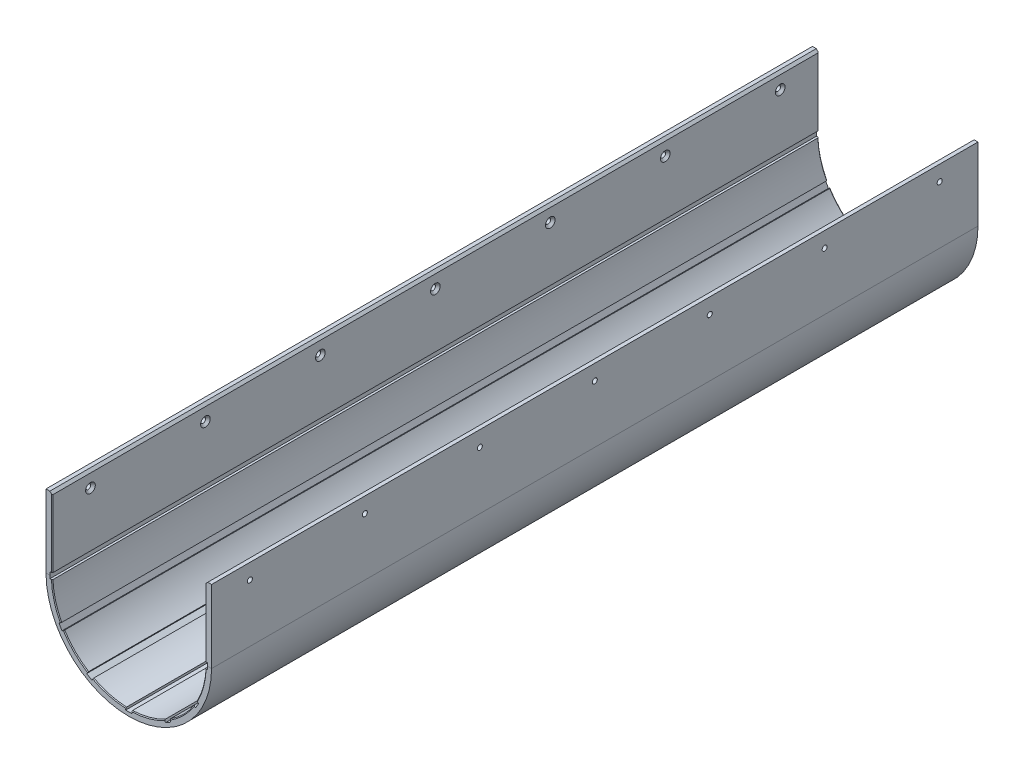
from build123d import *

# Parameters (mm, degrees)
SM_BASE_FLANGE_1_DEPTH     = 500
CHAMFER_2_SIZE             = 1
CUT_EXTRUDE_1_DEPTH        = 1012.596757607
PATTERN_CIRCULAR_1_COUNT   = 4
PATTERN_CIRCULAR_1_ANGLE   = 90
F_1_THE_OTHER_WAY_COUNT    = 4
F_1_THE_OTHER_WAY_ANGLE    = 90
CHAMFER_1_SIZE             = 3
HOLE_WIZARD_M61_AT_2_COUNT = 2
HOLE_WIZARD_M61_AT_2_PITCH = 150
HOLE_WIZARD_M61_AT_3_COUNT = 2
HOLE_WIZARD_M61_AT_3_PITCH = 300
HOLE_WIZARD_M61_AT_4_COUNT = 2
HOLE_WIZARD_M61_AT_4_PITCH = 450
HOLE_WIZARD_M61_AT_5_COUNT = 2
HOLE_WIZARD_M61_AT_5_PITCH = 600
HOLE_WIZARD_M61_AT_6_COUNT = 2
HOLE_WIZARD_M61_AT_6_PITCH = 750
HOLE_WIZARD_M61_AT_7_COUNT = 2
HOLE_WIZARD_M61_AT_7_PITCH = 900


# Sheet-metal steps are written as plain solids
with BuildPart() as part:
    # Sketch 2 → Базовая кромка1 (new, symmetric)
    with BuildSketch(Plane.XY):
        with BuildLine():
            Line((100, 95), (100, 0))
            ThreePointArc((100, 0), (0, -100), (-100, 0))
            Line((-100, 0), (-100, 95))
            Line((-100, 95), (-108, 95))
            Line((-108, 95), (-108, 0))
            ThreePointArc((-108, 0), (0, -108), (108, 0))
            Line((108, 0), (108, 95))
            Line((108, 95), (100, 95))
        make_face()
    extrude(amount=SM_BASE_FLANGE_1_DEPTH, both=True)

    # Фаска2
    chamfer_2_edges = [part.edges().sort_by_distance(p)[0] for p in [
        (100, 47.5, 500),
        (0, -100, 500),
        (-100, 47.5, 500),
        (0, -100, -500),
        (100, 47.5, -500),
        (-100, 47.5, -500),
    ]]
    chamfer(chamfer_2_edges, length=CHAMFER_2_SIZE)

    # Эскиз7 → Вырез-Вытянуть1 (cut, symmetric)
    with BuildSketch(Plane.XY.offset(500)):
        Polygon((0, 0), (-4, -102.92230079), (4, -102.92230079), align=None)
    cut_extrude_1 = extrude(amount=CUT_EXTRUDE_1_DEPTH, both=True, mode=Mode.SUBTRACT)

    # Круговой массив1: Вырез-Вытянуть1 ×4 about axis
    pattern_circular_1_axis = Axis((0, 0, 0), (0, 0, -1))
    for i in range(1, PATTERN_CIRCULAR_1_COUNT):
        add(cut_extrude_1.rotate(pattern_circular_1_axis, i * PATTERN_CIRCULAR_1_ANGLE / (PATTERN_CIRCULAR_1_COUNT - 1)), mode=Mode.SUBTRACT)

    # 1 the other way: Вырез-Вытянуть1 ×4 about axis
    f_1_the_other_way_axis = Axis((0, 0, 0), (0, 0, 1))
    for i in range(1, F_1_THE_OTHER_WAY_COUNT):
        add(cut_extrude_1.rotate(f_1_the_other_way_axis, i * F_1_THE_OTHER_WAY_ANGLE / (F_1_THE_OTHER_WAY_COUNT - 1)), mode=Mode.SUBTRACT)

    # Фаска1
    chamfer_1_edges = [part.edges().sort_by_distance(p)[0] for p in [
        (100, 95, 0),
        (-100, 95, 0),
    ]]
    chamfer(chamfer_1_edges, length=CHAMFER_1_SIZE)

    # Эскиз9 → Зенковка для винта с полупотайной головкой M61 (revolve, cut)
    with BuildSketch(Plane(origin=(-100, 75, 450), x_dir=(0, 0, -1), z_dir=(0, 1, 0))):
        Polygon((0, 0), (0, 18.982840043), (3.3, 17), (3.3, 3), (6.3, 0), align=None)
    hole_wizard_m61 = revolve(axis=Axis((-93.65, 75, 450), (-1, 0, 0)), mode=Mode.SUBTRACT)

    # Зенковка для винта с полупотайной головкой M61 at 2: Зенковка для винта с полупотайной головкой M61 ×2
    with Locations(*[(0, 0, -i * HOLE_WIZARD_M61_AT_2_PITCH) for i in range(1, HOLE_WIZARD_M61_AT_2_COUNT)]):
        add(hole_wizard_m61, mode=Mode.SUBTRACT)

    # Зенковка для винта с полупотайной головкой M61 at 3: Зенковка для винта с полупотайной головкой M61 ×2
    with Locations(*[(0, 0, -i * HOLE_WIZARD_M61_AT_3_PITCH) for i in range(1, HOLE_WIZARD_M61_AT_3_COUNT)]):
        add(hole_wizard_m61, mode=Mode.SUBTRACT)

    # Зенковка для винта с полупотайной головкой M61 at 4: Зенковка для винта с полупотайной головкой M61 ×2
    with Locations(*[(0, 0, -i * HOLE_WIZARD_M61_AT_4_PITCH) for i in range(1, HOLE_WIZARD_M61_AT_4_COUNT)]):
        add(hole_wizard_m61, mode=Mode.SUBTRACT)

    # Зенковка для винта с полупотайной головкой M61 at 5: Зенковка для винта с полупотайной головкой M61 ×2
    with Locations(*[(0, 0, -i * HOLE_WIZARD_M61_AT_5_PITCH) for i in range(1, HOLE_WIZARD_M61_AT_5_COUNT)]):
        add(hole_wizard_m61, mode=Mode.SUBTRACT)

    # Зенковка для винта с полупотайной головкой M61 at 6: Зенковка для винта с полупотайной головкой M61 ×2
    with Locations(*[(0, 0, -i * HOLE_WIZARD_M61_AT_6_PITCH) for i in range(1, HOLE_WIZARD_M61_AT_6_COUNT)]):
        add(hole_wizard_m61, mode=Mode.SUBTRACT)

    # Зенковка для винта с полупотайной головкой M61 at 7: Зенковка для винта с полупотайной головкой M61 ×2
    with Locations(*[(0, 0, -i * HOLE_WIZARD_M61_AT_7_PITCH) for i in range(1, HOLE_WIZARD_M61_AT_7_COUNT)]):
        add(hole_wizard_m61, mode=Mode.SUBTRACT)

    # Зеркальное отражение1: Зенковка для винта с полупотайной головкой M61 across plane
    add(hole_wizard_m61.mirror(Plane(origin=(0, 0, 0), x_dir=(0, 0, 1), z_dir=(1, 0, 0))), mode=Mode.SUBTRACT)

    # Зеркальное отражение1 copy 1 sketch → Зеркальное отражение1 copy 1 (revolve, cut)
    with BuildSketch(Plane(origin=(100, 75, 300), x_dir=(0, 0, -1), z_dir=(0, 1, 0))):
        Polygon((0, 0), (0, -18.982840043), (3.3, -17), (3.3, -3), (6.3, 0), align=None)
    revolve(axis=Axis((93.65, 75, 300), (-1, 0, 0)), mode=Mode.SUBTRACT)

    # Зеркальное отражение1 copy 2 sketch → Зеркальное отражение1 copy 2 (revolve, cut)
    with BuildSketch(Plane(origin=(100, 75, 150), x_dir=(0, 0, -1), z_dir=(0, 1, 0))):
        Polygon((0, 0), (0, -18.982840043), (3.3, -17), (3.3, -3), (6.3, 0), align=None)
    revolve(axis=Axis((93.65, 75, 150), (-1, 0, 0)), mode=Mode.SUBTRACT)

    # Зеркальное отражение1 copy 3 sketch → Зеркальное отражение1 copy 3 (revolve, cut)
    with BuildSketch(Plane(origin=(100, 75, 0), x_dir=(0, 0, -1), z_dir=(0, 1, 0))):
        Polygon((0, 0), (0, -18.982840043), (3.3, -17), (3.3, -3), (6.3, 0), align=None)
    revolve(axis=Axis((93.65, 75, 0), (-1, 0, 0)), mode=Mode.SUBTRACT)

    # Зеркальное отражение1 copy 4 sketch → Зеркальное отражение1 copy 4 (revolve, cut)
    with BuildSketch(Plane(origin=(100, 75, -150), x_dir=(0, 0, -1), z_dir=(0, 1, 0))):
        Polygon((0, 0), (0, -18.982840043), (3.3, -17), (3.3, -3), (6.3, 0), align=None)
    revolve(axis=Axis((93.65, 75, -150), (-1, 0, 0)), mode=Mode.SUBTRACT)

    # Зеркальное отражение1 copy 5 sketch → Зеркальное отражение1 copy 5 (revolve, cut)
    with BuildSketch(Plane(origin=(100, 75, -300), x_dir=(0, 0, -1), z_dir=(0, 1, 0))):
        Polygon((0, 0), (0, -18.982840043), (3.3, -17), (3.3, -3), (6.3, 0), align=None)
    revolve(axis=Axis((93.65, 75, -300), (-1, 0, 0)), mode=Mode.SUBTRACT)

    # Зеркальное отражение1 copy 6 sketch → Зеркальное отражение1 copy 6 (revolve, cut)
    with BuildSketch(Plane(origin=(100, 75, -450), x_dir=(0, 0, -1), z_dir=(0, 1, 0))):
        Polygon((0, 0), (0, -18.982840043), (3.3, -17), (3.3, -3), (6.3, 0), align=None)
    revolve(axis=Axis((93.65, 75, -450), (-1, 0, 0)), mode=Mode.SUBTRACT)


solid = part.part
